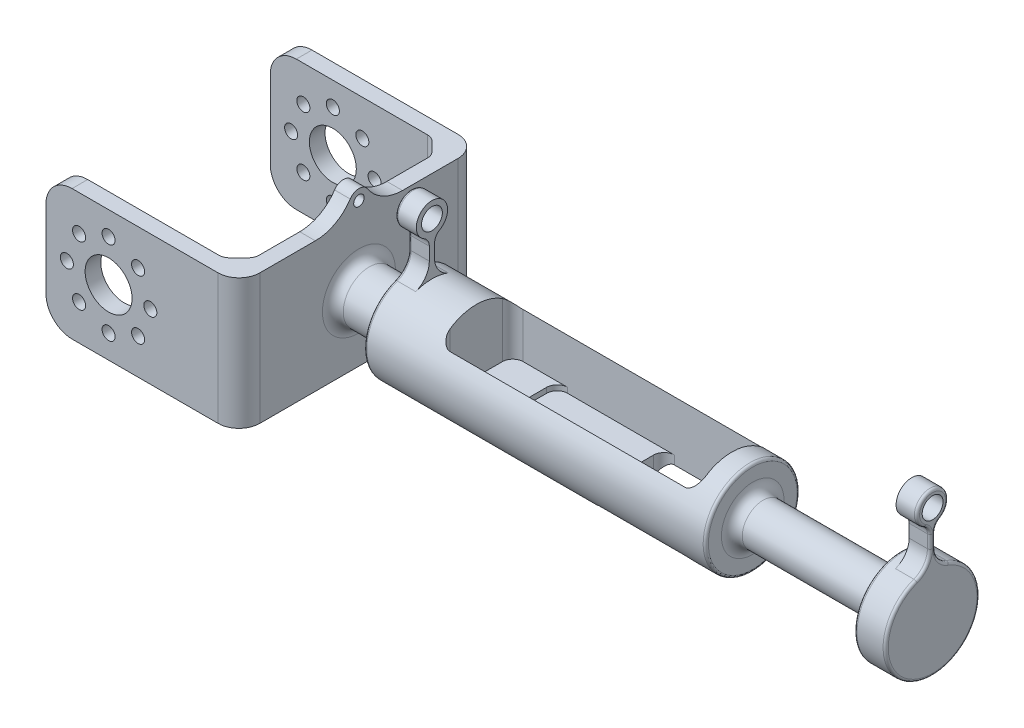
from build123d import *

# Parameters (mm, degrees)
SKETCH3_W                                           = 4
SKETCH3_H                                           = 1
BOSS_EXTRUDE1_DEPTH                                 = 50
BOSS_EXTRUDE1_DEPTH_BACK                            = 50
SKETCH2_R                                           = 9
SKETCH5_W                                           = 1
SKETCH5_H                                           = 9
EXTRUDE_THIN1_DEPTH                                 = 4
FILLET2_R                                           = 2
FILLET1_R                                           = 4
CUT_EXTRUDE1_DEPTH                                  = 56.362442143
CUT_EXTRUDE1_DEPTH_BACK                             = 4
SKETCH7_W                                           = 49
SKETCH7_H                                           = 14
SKETCH7_5_W                                         = 20
SKETCH7_5_H                                         = 14
CUT_EXTRUDE2_DEPTH                                  = 56.362442143
FILLET3_R                                           = 2
BOSS_EXTRUDE2_START                                 = -4
SKETCH7_4_W                                         = 8.5
SKETCH7_4_H                                         = 14
BOSS_EXTRUDE2_DEPTH                                 = 1
CBORE_FOR_00_BINDING_HEAD_MACHINE_SCREW_D           = 1.397
CBORE_FOR_00_BINDING_HEAD_MACHINE_SCREW_CBORE_D     = 3.175
CBORE_FOR_00_BINDING_HEAD_MACHINE_SCREW_CBORE_DEPTH = 2.711196
FILLET11_R                                          = 2
BOSS_EXTRUDE4_START                                 = -60
SKETCH2_2_R                                         = 5
BOSS_EXTRUDE4_DEPTH                                 = 10
SPLIT1_SURFACE_1_1_BACK                             = 116.694
SPLIT1_SURFACE_1_1_DEPTH                            = 233.388
SPLIT1_SURFACE_1_2_BACK                             = 116.694
SPLIT1_SURFACE_1_2_DEPTH                            = 233.388
SPLIT1_SURFACE_2_3_BACK                             = 116.694
SPLIT1_SURFACE_2_3_DEPTH                            = 233.388
SPLIT1_SURFACE_2_4_BACK                             = 116.694
SPLIT1_SURFACE_2_4_DEPTH                            = 233.388
MOVE_START                                          = 15.5
MOVE_FACE1_OUTLINE_R                                = 9
MOVE_FACE1_OUTLINE_R_2                              = 4
MOVE_FACE1_DEPTH                                    = 28.5
SHELL3_T                                            = -2
SKETCH12_W                                          = 40
SKETCH12_H                                          = 25
BOSS_EXTRUDE3_DEPTH                                 = 3
FILLET5_R                                           = 2
BOSS_EXTRUDE5_START                                 = -20
SKETCH14_W                                          = 37
SKETCH14_H                                          = 25
BOSS_EXTRUDE5_DEPTH                                 = 3
CUT_EXTRUDE3_DEPTH                                  = 103.088197163
CUT_EXTRUDE3_DEPTH_BACK                             = 103.088197163
SKETCH15_R                                          = 4.5
SKETCH15_R_2                                        = 1.25
FILLET6_R                                           = 4
CHAMFER1_SIZE                                       = 3
FILLET10_R                                          = 2
FILLET8_R                                           = 5
FILLET9_R                                           = 0.5
SKETCH17_W                                          = 3
SKETCH17_H                                          = 1
SKETCH18_W                                          = 2
SKETCH18_H                                          = 1.5
EXTRUDE_THIN2_DEPTH                                 = 3
FILLET12_R                                          = 8
FILLET13_R                                          = 8


# Read off the part's stored shape, not the designer's step: Move Face1
# Some blends are built 0.0001 mm under size
with BuildPart() as part:
    # Sketch3 → Revolve1 (revolve)
    with BuildSketch(Plane.XY, mode=Mode.PRIVATE) as revolve1_sk:
        with Locations((-48, 16.5)):
            Rectangle(SKETCH3_W, SKETCH3_H)
    revolve(revolve1_sk.sketch.rotate(Axis((-50, 19, 0), (1, 0, 0)), 270), axis=Axis((-50, 19, 0), (1, 0, 0)))

    # Sketch5 → Extrude-Thin1 (add)
    with BuildSketch(Plane(origin=(-50, 0, 75), x_dir=(0, 0, 1), z_dir=(-1, 0, 0))):
        with Locations((-75, 12.5)):
            Rectangle(SKETCH5_W, SKETCH5_H)
    extrude(amount=-EXTRUDE_THIN1_DEPTH)

    # Fillet2
    fillet2_edges = [part.edges().sort_by_distance(p)[0] for p in [
        (-48, 16.041960108, 0.5),
        (-48, 16.041960108, -0.5),
    ]]
    fillet(fillet2_edges, radius=FILLET2_R)


with BuildPart() as body_2:
    # Sketch2 → Boss-Extrude1 (new, two sides: drawn at the far end of the back side and taken through both)
    with BuildSketch(Plane(origin=(0, 0, 0), x_dir=(0, 0, -1), z_dir=(1, 0, 0)).offset(-BOSS_EXTRUDE1_DEPTH_BACK)):
        Circle(SKETCH2_R)
    extrude(amount=BOSS_EXTRUDE1_DEPTH + BOSS_EXTRUDE1_DEPTH_BACK)


with BuildPart() as body_3:
    # Mirror3: mirrored copy
    add(part.part.mirror(Plane(origin=(0, 0, 0), x_dir=(0, 0, 1), z_dir=(1, 0, 0))))


with BuildPart() as part_1:
    add(part.part)

    # Combine1: union body 3, body 2
    add(body_3.part)
    add(body_2.part)

    # Fillet1
    fillet1_edges = [part_1.edges().sort_by_distance(p)[0] for p in [
        (-48, 8.986100378, 0.5),
        (-48, 8.986100378, -0.5),
        (48, 8.986100378, -0.5),
        (48, 8.986100378, 0.5),
    ]]
    fillet(fillet1_edges, radius=FILLET1_R)

    # Sketch7 → Cut-Extrude1 (cut, two sides: drawn at the far end of the back side and taken through both)
    with BuildSketch(Plane(origin=(0, 0, 0), x_dir=(1, 0, 0), z_dir=(0, 1, 0)).offset(-CUT_EXTRUDE1_DEPTH_BACK)):
        with Locations((-13, 0)):
            Rectangle(SKETCH7_W, SKETCH7_H)
    extrude(amount=CUT_EXTRUDE1_DEPTH + CUT_EXTRUDE1_DEPTH_BACK, mode=Mode.SUBTRACT)

    # Sketch7<5> → Cut-Extrude2 (cut, through all)
    with BuildSketch(Plane(origin=(0, 0, 0), x_dir=(1, 0, 0), z_dir=(0, 1, 0))):
        with Locations((1.5, 0)):
            Rectangle(SKETCH7_5_W, SKETCH7_5_H)
    extrude(amount=-CUT_EXTRUDE2_DEPTH, mode=Mode.SUBTRACT)

    # Fillet3
    fillet3_edges = [part_1.edges().sort_by_distance(p)[0] for p in [
        (11.5, 0, 7),
        (-37.5, 0.828427125, 7),
        (-37.5, 0.828427125, -7),
        (11.5, 0, -7),
        (-8.5, -4.828427125, -7),
        (-8.5, -4.828427125, 7),
    ]]
    fillet(fillet3_edges, radius=FILLET3_R)

    # Sketch7<4> → Boss-Extrude2 (add)
    with BuildSketch(Plane(origin=(0, 0, 0), x_dir=(1, 0, 0), z_dir=(0, 1, 0)).offset(BOSS_EXTRUDE2_START)):
        with Locations((-33.25, 0)):
            Rectangle(SKETCH7_4_W, SKETCH7_4_H)
    extrude(amount=BOSS_EXTRUDE2_DEPTH)

    # CBORE for #00 Binding Head Machine Screw1 (through all)
    with Locations(Plane(origin=(0, -9, 0), x_dir=(-1, 0, 0), z_dir=(0, -1, 0))):
        with Locations((33, 0)):
            CounterBoreHole(CBORE_FOR_00_BINDING_HEAD_MACHINE_SCREW_D / 2, CBORE_FOR_00_BINDING_HEAD_MACHINE_SCREW_CBORE_D / 2, CBORE_FOR_00_BINDING_HEAD_MACHINE_SCREW_CBORE_DEPTH)

    # Fillet11
    fillet11_edges = [part_1.edges().sort_by_distance(p)[0] for p in [
        (-29, -3.5, -7),
        (-29, -3.5, 7),
    ]]
    fillet(fillet11_edges, radius=FILLET11_R)

    # Sketch2<2> → Boss-Extrude4 (add)
    with BuildSketch(Plane(origin=(0, 0, 0), x_dir=(0, 0, -1), z_dir=(1, 0, 0)).offset(BOSS_EXTRUDE4_START)):
        with Locations(Location((0, 0, 0), (0, 0, 180))):
            Circle(SKETCH2_2_R)
    extrude(amount=BOSS_EXTRUDE4_DEPTH)


with BuildPart() as body_2_2:
    # Split1: the piece behind the surface
    add(part_1.part)
    # Split1 surface 1: a surface, the sketch's curves swept straight by 233.388 mm
    with BuildLine(Plane.XY.offset(9).offset(-SPLIT1_SURFACE_1_1_BACK), mode=Mode.PRIVATE) as split1_surface_1_1_path:
        Line((15.5, -30), (15.5, 30))
    split1_surface_1_1 = Shell.extrude(split1_surface_1_1_path.wire(), (0 * SPLIT1_SURFACE_1_1_DEPTH, 0 * SPLIT1_SURFACE_1_1_DEPTH, 1 * SPLIT1_SURFACE_1_1_DEPTH))
    split(bisect_by=split1_surface_1_1, keep=Keep.BOTTOM)


with BuildPart() as part_2:
    add(part_1.part)

    # Split1: split by a surface, the side it looks to stays
    # Split1 surface 1: a surface, the sketch's curves swept straight by 233.388 mm
    with BuildLine(Plane.XY.offset(9).offset(-SPLIT1_SURFACE_1_2_BACK), mode=Mode.PRIVATE) as split1_surface_1_2_path:
        Line((15.5, -30), (15.5, 30))
    split1_surface_1_2 = Shell.extrude(split1_surface_1_2_path.wire(), (0 * SPLIT1_SURFACE_1_2_DEPTH, 0 * SPLIT1_SURFACE_1_2_DEPTH, 1 * SPLIT1_SURFACE_1_2_DEPTH))
    split(bisect_by=split1_surface_1_2, keep=Keep.TOP)


with BuildPart() as body_3_2:
    # Split1 2 body 2 2: the piece behind the surface
    add(body_2_2.part)
    # Split1 surface 2: a surface, the sketch's curves swept straight by 233.388 mm
    with BuildLine(Plane.XY.offset(9).offset(-SPLIT1_SURFACE_2_3_BACK), mode=Mode.PRIVATE) as split1_surface_2_3_path:
        Line((44, -30), (44, 30))
    split1_surface_2_3 = Shell.extrude(split1_surface_2_3_path.wire(), (0 * SPLIT1_SURFACE_2_3_DEPTH, 0 * SPLIT1_SURFACE_2_3_DEPTH, 1 * SPLIT1_SURFACE_2_3_DEPTH))
    split(bisect_by=split1_surface_2_3, keep=Keep.BOTTOM)


with BuildPart() as body_2_2_1:
    add(body_2_2.part)

    # Split1 2 body 2 2: split by a surface, the side it looks to stays
    # Split1 surface 2: a surface, the sketch's curves swept straight by 233.388 mm
    with BuildLine(Plane.XY.offset(9).offset(-SPLIT1_SURFACE_2_4_BACK), mode=Mode.PRIVATE) as split1_surface_2_4_path:
        Line((44, -30), (44, 30))
    split1_surface_2_4 = Shell.extrude(split1_surface_2_4_path.wire(), (0 * SPLIT1_SURFACE_2_4_DEPTH, 0 * SPLIT1_SURFACE_2_4_DEPTH, 1 * SPLIT1_SURFACE_2_4_DEPTH))
    split(bisect_by=split1_surface_2_4, keep=Keep.TOP)

    # Move Face1 outline → Move Face1 (cut)
    with BuildSketch(Plane.YZ.offset(MOVE_START)):
        Circle(MOVE_FACE1_OUTLINE_R)
        Circle(MOVE_FACE1_OUTLINE_R_2, mode=Mode.SUBTRACT)
    extrude(amount=MOVE_FACE1_DEPTH, mode=Mode.SUBTRACT)

    # Shell3
    shell3_openings = [body_2_2_1.faces().sort_by_distance(p)[0] for p in [
        (15.5, 0, 0),
        (44, 0, 0),
    ]]
    offset(amount=SHELL3_T, openings=shell3_openings, kind=Kind.INTERSECTION)


with BuildPart() as part_3:
    add(part_2.part)

    # Combine3: union body 2 2, body 3 2
    add(body_2_2_1.part)
    add(body_3_2.part)

    # Sketch12 → Boss-Extrude3 (add)
    with BuildSketch(Plane.ZY.offset(60)):
        Rectangle(SKETCH12_W, SKETCH12_H)
    extrude(amount=BOSS_EXTRUDE3_DEPTH)

    # Fillet5
    fillet5_edges = [part_3.edges().sort_by_distance(p)[0] for p in [
        (-50, 0, -5),
        (-60, 0, -5),
        (15.5, -4, 0),
        (44, -4, 0),
    ]]
    fillet(fillet5_edges, radius=FILLET5_R)


with BuildPart() as body_2_3:
    # Sketch14 → Boss-Extrude5 (new body)
    with BuildSketch(Plane.XY.offset(BOSS_EXTRUDE5_START)):
        with Locations((-78.5, 0)):
            Rectangle(SKETCH14_W, SKETCH14_H)
    extrude(amount=-BOSS_EXTRUDE5_DEPTH)


with BuildPart() as body_3_3:
    # Mirror8: mirrored copy
    add(body_2_3.part.mirror(Plane.XY))

    # Combine2: union part, body 2 3
    add(part_3.part)
    add(body_2_3.part)

    # Sketch15 → Cut-Extrude3 (cut, two sides: drawn at the far end of the back side and taken through both)
    with BuildSketch(Plane.XY.offset(-CUT_EXTRUDE3_DEPTH_BACK)):
        with Locations((-85, 0)):
            Circle(SKETCH15_R)
        with Locations((-93, 0)):
            Circle(SKETCH15_R_2)
        with Locations((-90.656854249, 5.656854249)):
            Circle(SKETCH15_R_2)
        with Locations((-85, 8)):
            Circle(SKETCH15_R_2)
        with Locations((-79.343145751, 5.656854249)):
            Circle(SKETCH15_R_2)
        with Locations((-77, 0)):
            Circle(SKETCH15_R_2)
        with Locations((-79.343145751, -5.656854249)):
            Circle(SKETCH15_R_2)
        with Locations((-85, -8)):
            Circle(SKETCH15_R_2)
        with Locations((-90.656854249, -5.656854249)):
            Circle(SKETCH15_R_2)
    extrude(amount=CUT_EXTRUDE3_DEPTH + CUT_EXTRUDE3_DEPTH_BACK, mode=Mode.SUBTRACT)

    # Fillet6
    fillet6_edges = [body_3_3.edges().sort_by_distance(p)[0] for p in [
        (-60, 0, -23),
        (-60, 0, 23),
    ]]
    fillet(fillet6_edges, radius=FILLET6_R)

    # Chamfer1
    chamfer1_edges = [body_3_3.edges().sort_by_distance(p)[0] for p in [
        (-63, 0, 20),
        (-63, 0, -20),
    ]]
    chamfer(chamfer1_edges, length=CHAMFER1_SIZE)

    # Fillet10
    fillet10_edges = [body_3_3.edges().sort_by_distance(p)[0] for p in [
        (-63, 0, -17),
        (-63, 0, 17),
        (-66, 0, 20),
        (-66, 0, -20),
    ]]
    fillet(fillet10_edges, radius=FILLET10_R)

    # Fillet8
    fillet8_edges = [body_3_3.edges().sort_by_distance(p)[0] for p in [
        (-97, 12.5, -21.5),
        (-97, -12.5, -21.5),
        (-97, -12.5, 21.5),
        (-97, 12.5, 21.5),
    ]]
    fillet(fillet8_edges, radius=FILLET8_R)

    # Fillet9
    fillet9_edges = [body_3_3.edges().sort_by_distance(p)[0] for p in [
        (15.5, 0, 9),
        (-50, -7.383713887, 5.145946874),
        (-50, 13.433091949, 0.5),
        (-50, 13.433091949, -0.5),
        (-50, 9.909223418, -1.218349383),
        (-50, 9.909223418, 1.218349383),
        (-50, 15.669872981, 0.767949192),
        (-50, 22, 0),
        (-50, 15.669872981, -0.767949192),
        (50, 15.669872981, -0.767949192),
        (50, 22, 0),
        (50, 15.669872981, 0.767949192),
        (50, 13.433091949, -0.5),
        (50, 13.433091949, 0.5),
        (50, 9.909223418, 1.218349383),
        (50, -7.383713887, 5.145946874),
        (50, 9.909223418, -1.218349383),
        (44, 0, 9),
    ]]
    fillet(fillet9_edges, radius=FILLET9_R)



with BuildPart() as body_2_4:
    # Sketch17 → Revolve2 (revolve)
    with BuildSketch(Plane.XY, mode=Mode.PRIVATE) as revolve2_sk:
        with Locations((-61.5, 13.5)):
            Rectangle(SKETCH17_W, SKETCH17_H)
    revolve(revolve2_sk.sketch.rotate(Axis((-61.869732406, 15, 0), (1, 0, 0)), 270), axis=Axis((-61.869732406, 15, 0), (1, 0, 0)))


with BuildPart() as body_3_3_1:
    add(body_3_3.part)

    add(body_2_4.part)  # Extrude-Thin2 merges body 2 4
    # Sketch18 → Extrude-Thin2 (add)
    with BuildSketch(Plane.ZY.offset(63)):
        with Locations((0, 13.25)):
            Rectangle(SKETCH18_W, SKETCH18_H)
    extrude(amount=-EXTRUDE_THIN2_DEPTH)

    # Fillet12
    # the kernel refuses this fillet: 8 mm, written as the material it adds along each edge
    with BuildSketch(Plane(origin=(-63, 12.5, -1), x_dir=(0, 0, -1), z_dir=(1, 0, 0))) as fillet12_piece_1:
        with BuildLine():
            CenterArc((3.420152207, 8), FILLET12_R, 244.68978598, 25.31021402)
            Line((0, 0.767949192), (-0.068403044, 0.623308176))
            ThreePointArc((-0.068403044, 0.623308176), (-0.16, 0.383974596), (-0.16, 0))
            Line((-0.16, 0), (0, -0.16))
            Line((0, -0.16), (3.420152207, -0.16))
            Line((3.420152207, -0.16), (3.420152207, 0))
        make_face()
    extrude(amount=3)
    with BuildSketch(Plane(origin=(-63, 12.5, 1), x_dir=(0, 1, 0), z_dir=(1, 0, 0))) as fillet12_piece_2:
        with BuildLine():
            CenterArc((8, 3.420152207), FILLET12_R, 180, 25.31021402)
            Line((0, 3.420152207), (-0.16, 3.420152207))
            Line((-0.16, 3.420152207), (-0.16, 0))
            Line((-0.16, 0), (0, -0.16))
            ThreePointArc((0, -0.16), (0.383974596, -0.16), (0.623308176, -0.068403044))
            Line((0.623308176, -0.068403044), (0.767949192, 0))
        make_face()
    extrude(amount=3)

    # Fillet13
    fillet13_edges = [body_3_3_1.edges().sort_by_distance(p)[0] for p in [
        (-61.5, 13.267949192, -1),
        (-61.5, 13.267949192, 1),
    ]]
    fillet(fillet13_edges, radius=FILLET13_R - 0.0001)  # a hair under: the kernel refuses the full size


solid = body_3_3_1.part
